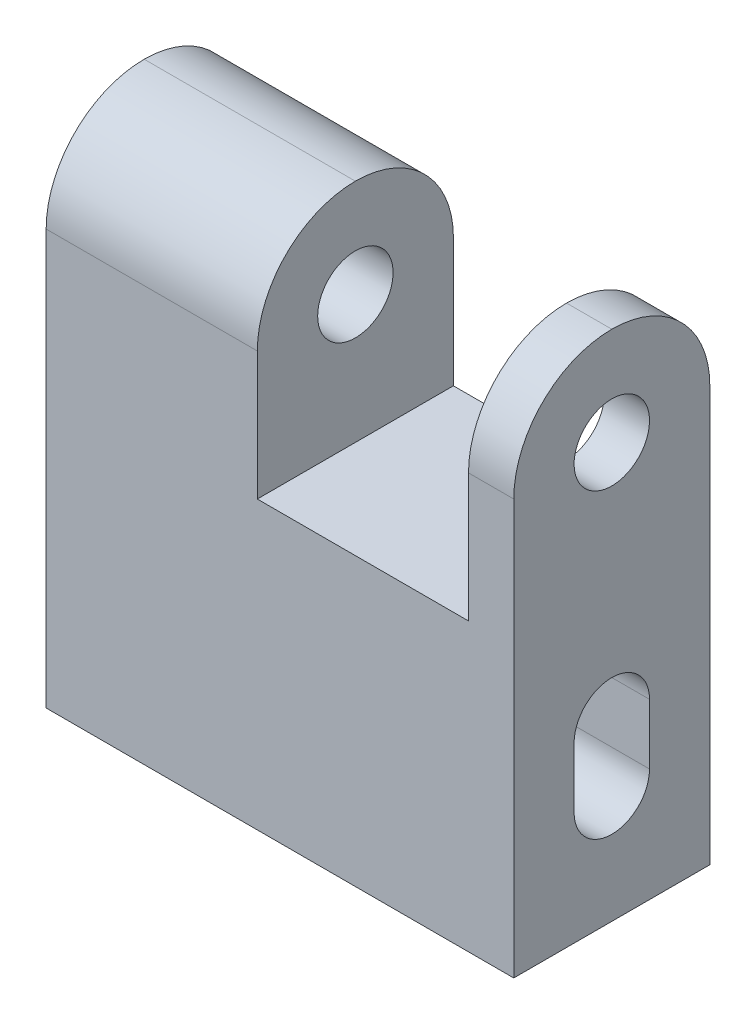
from build123d import *

# Parameters (mm, degrees)
BOSS_EXTRUDE1_DEPTH     = 13
CUT_EXTRUDE1_DEPTH      = 48.812132352
CUT_EXTRUDE2_DEPTH      = 48.812132352
CUT_EXTRUDE2_DEPTH_BACK = 48.812132352
SKETCH5_R               = 2.5
FILLET1_R               = 6.5
SKETCH6_R               = 2
CUT_EXTRUDE3_DEPTH      = 8


with BuildPart() as part:
    # Sketch2 → Boss-Extrude1 (new body)
    with BuildSketch(Plane.XY):
        Polygon((0, 0), (0, -34), (31, -34), (31, 0), (28, 0), (28, -15), (14, -15), (14, 0), align=None)
    extrude(amount=BOSS_EXTRUDE1_DEPTH)

    # Sketch4 → Cut-Extrude1 (cut, through all)
    with BuildSketch(Plane.ZY):
        with BuildLine():
            Line((4, -26.5), (4, -22.5))
            ThreePointArc((4, -22.5), (6.5, -20), (9, -22.5))
            Line((9, -22.5), (9, -26.5))
            ThreePointArc((9, -26.5), (6.5, -29), (4, -26.5))
        make_face()
    extrude(amount=-CUT_EXTRUDE1_DEPTH, mode=Mode.SUBTRACT)

    # Sketch5 → Cut-Extrude2 (cut, two sides: drawn at the far end of the back side and taken through both)
    with BuildSketch(Plane(origin=(31, 0, 0), x_dir=(0, 0, -1), z_dir=(1, 0, 0)).offset(-CUT_EXTRUDE2_DEPTH_BACK)):
        with Locations(Location((-6.5, -6.5, 0), (0, 0, 90))):
            Circle(SKETCH5_R)
    extrude(amount=CUT_EXTRUDE2_DEPTH + CUT_EXTRUDE2_DEPTH_BACK, mode=Mode.SUBTRACT)

    # Fillet1
    fillet1_edges = [part.edges().sort_by_distance(p)[0] for p in [
        (29.5, 0, 13),
        (7, 0, 13),
        (7, 0, 0),
        (29.5, 0, 0),
    ]]
    fillet(fillet1_edges, radius=FILLET1_R - 0.0001)  # a hair under: the kernel refuses the full size

    # Sketch6 → Cut-Extrude3 (cut)
    with BuildSketch(Plane.XZ.offset(34)):
        with Locations((15.5, 6.5)):
            Circle(SKETCH6_R)
    extrude(amount=-CUT_EXTRUDE3_DEPTH, mode=Mode.SUBTRACT)


solid = part.part
